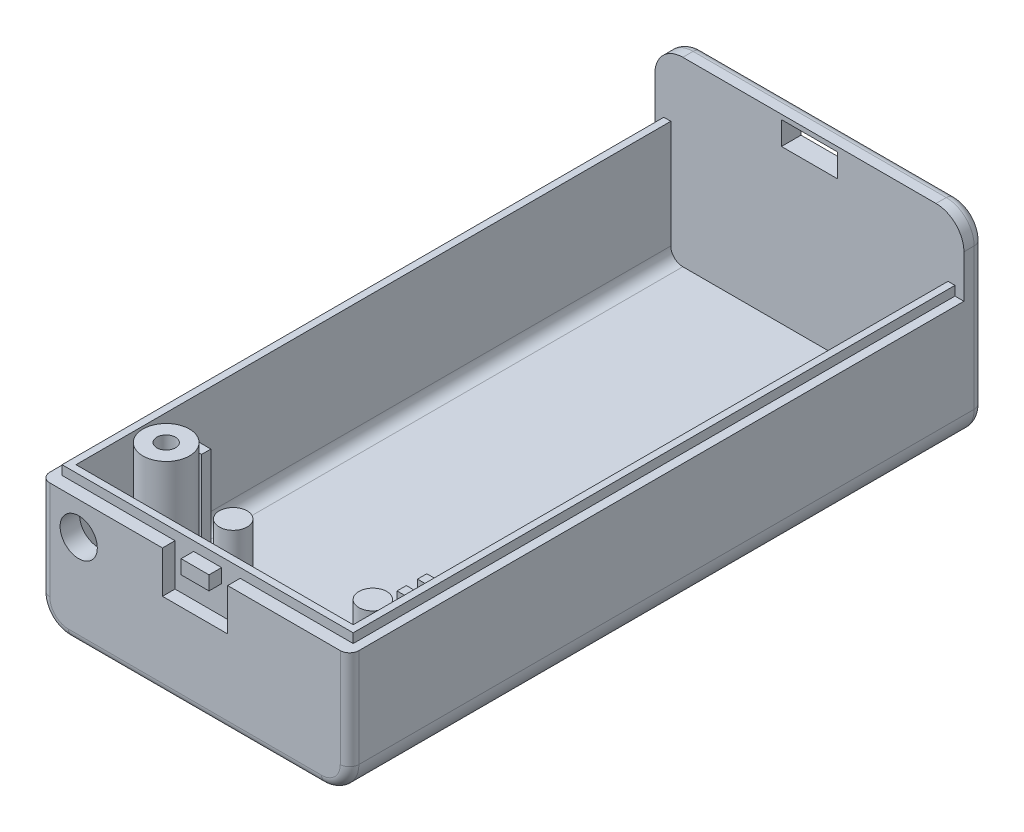
from build123d import *

# Parameters (mm, degrees)
EXTRU_MINCE1_DEPTH         = 32
EXTRU_MINCE1_DEPTH_BACK    = 32
BOSS_EXTRU_1_DEPTH         = 2
BOSS_EXTRU_1_DEPTH_BACK    = 0.1
BOSS_EXTRU_2_START         = 2.1
ESQUISSE3_W                = 6
ESQUISSE3_H                = 2.5
BOSS_EXTRU_2_DEPTH         = 2.1
ESQUISSE4_W                = 7
ESQUISSE4_H                = 5.5
BOSS_EXTRU_3_DEPTH         = 0.75
ENL_V_MAT_EXTRU_2_DEPTH    = 1
CONG_1_R                   = 1
ESQUISSE6_W                = 4
ESQUISSE6_H                = 11.1
BOSS_EXTRU_4_DEPTH         = 1
R_P_TITION_LIN_AIRE1_COUNT = 2
R_P_TITION_LIN_AIRE1_PITCH = 2.2
ESQUISSE7_R                = 2.5
ESQUISSE7_R_2              = 1
BOSS_EXTRU_5_DEPTH         = 15.4
ESQUISSE8_R                = 1.5
BOSS_EXTRU_6_DEPTH         = 11.89
ESQUISSE9_W                = 8
ESQUISSE9_H                = 3.75
ENL_V_MAT_EXTRU_3_DEPTH    = 43.640709422
ESQUISSE10_W               = 0.557692308
ESQUISSE10_H               = 0.173076923
BOSS_EXTRU_7_DEPTH         = 0.1
ENL_V_MAT_EXTRU_5_REACH    = 73.619
ESQUISSE11_R               = 2
ESQUISSE12_W               = 3
ESQUISSE12_H               = 1.5
BOSS_EXTRU_8_DEPTH         = 1.35


with BuildPart() as part:
    # Esquisse1 → Extru.-Mince1 (new, two sides: drawn at the far end of the back side and taken through both)
    with BuildSketch(Plane.XY.offset(-EXTRU_MINCE1_DEPTH_BACK)):
        with BuildLine():
            Line((-16.6, 0), (-16.6, -11.6))
            ThreePointArc((-16.6, -11.6), (-15.721320344, -13.721320344), (-13.6, -14.6))
            Line((-13.6, -14.6), (13.6, -14.6))
            ThreePointArc((13.6, -14.6), (15.721320344, -13.721320344), (16.6, -11.6))
            Line((16.6, -11.6), (16.6, 0))
            Line((16.6, 0), (14.89, 0))
            Line((14.89, 0), (14.89, -11.6))
            ThreePointArc((14.89, -11.6), (14.512167748, -12.512167748), (13.6, -12.89))
            Line((13.6, -12.89), (-13.6, -12.89))
            ThreePointArc((-13.6, -12.89), (-14.512167748, -12.512167748), (-14.89, -11.6))
            Line((-14.89, -11.6), (-14.89, 0))
            Line((-14.89, 0), (-16.6, 0))
        make_face()
    extrude(amount=EXTRU_MINCE1_DEPTH + EXTRU_MINCE1_DEPTH_BACK)

    # Esquisse2 → Boss.-Extru.1 (add, two sides: drawn at the far end of the back side and taken through both)
    with BuildSketch(Plane.XY.offset(32).offset(-BOSS_EXTRU_1_DEPTH_BACK)):
        with BuildLine():
            Line((16.6, -11.6), (16.6, 0))
            Line((16.6, 0), (3.5, 0))
            Line((3.5, 0), (3.5, -5.5))
            Line((3.5, -5.5), (-3.5, -5.5))
            Line((-3.5, -5.5), (-3.5, 0))
            Line((-3.5, 0), (-16.6, 0))
            Line((-16.6, 0), (-16.6, -11.6))
            ThreePointArc((-16.6, -11.6), (-15.721320344, -13.721320344), (-13.6, -14.6))
            Line((-13.6, -14.6), (13.6, -14.6))
            ThreePointArc((13.6, -14.6), (15.721320344, -13.721320344), (16.6, -11.6))
        make_face()
    extrude(amount=BOSS_EXTRU_1_DEPTH + BOSS_EXTRU_1_DEPTH_BACK)

    # Esquisse3 → Boss.-Extru.2 (add)
    with BuildSketch(Plane(origin=(0, 0, -32), x_dir=(-1, 0, 0), z_dir=(0, 0, -1)).offset(BOSS_EXTRU_2_START)):
        with BuildLine():
            Line((-16.6, 3.6), (-16.6, -11.6))
            ThreePointArc((-16.6, -11.6), (-15.721320344, -13.721320344), (-13.6, -14.6))
            Line((-13.6, -14.6), (13.6, -14.6))
            ThreePointArc((13.6, -14.6), (15.721320344, -13.721320344), (16.6, -11.6))
            Line((16.6, -11.6), (16.6, 3.6))
            ThreePointArc((16.6, 3.6), (15.721320344, 5.721320344), (13.6, 6.6))
            Line((13.6, 6.6), (-13.6, 6.6))
            ThreePointArc((-13.6, 6.6), (-15.721320344, 5.721320344), (-16.6, 3.6))
        make_face()
        with Locations((0, 4.85)):
            Rectangle(ESQUISSE3_W, ESQUISSE3_H, mode=Mode.SUBTRACT)
    extrude(amount=-BOSS_EXTRU_2_DEPTH)

    # Esquisse4 → Boss.-Extru.3 (add)
    with BuildSketch(Plane(origin=(0, 0, 31.9), x_dir=(-1, 0, 0), z_dir=(0, 0, -1))):
        with Locations((0, -2.75)):
            Rectangle(ESQUISSE4_W, ESQUISSE4_H)
    extrude(amount=-BOSS_EXTRU_3_DEPTH)

    # Esquisse5 → Enlèv. mat.-Extru.2 (cut)
    with BuildSketch(Plane(origin=(0, 0, 0), x_dir=(1, 0, 0), z_dir=(0, 1, 0))):
        Polygon((-15.64, 32), (-15.64, -32.65), (15.64, -32.65), (15.64, 32), (20.225848864, 32), (20.225848864, -40.091584482), (-17.213856389, -40.091584482), (-17.213856389, 32), align=None)
    extrude(amount=-ENL_V_MAT_EXTRU_2_DEPTH, mode=Mode.SUBTRACT)

    # Congé1
    # the kernel refuses this fillet: 1 mm, written as the material it takes off along each edge
    with BuildSketch(Plane(origin=(-16.6, 1.5, 34), x_dir=(0, 0, -1), z_dir=(0, -1, 0)), Plane(origin=(16.6, -11.6, 34), x_dir=(0, 0, -1), z_dir=(0, 1, 0))) as cong_1_piece_1:
        with BuildLine():
            CenterArc((CONG_1_R, CONG_1_R), CONG_1_R, 180, 90)
            Line((0, CONG_1_R), (0, 0))
            Line((0, 0), (CONG_1_R, 0))
        make_face()
    extrude(amount=13.1, mode=Mode.SUBTRACT)
    with BuildSketch(Plane(origin=(-13.6, -11.6, 34), x_dir=(-1, 0, 0), z_dir=(0, 1, 0))) as cong_1_piece_2:
        with BuildLine():
            CenterArc((3 - CONG_1_R, -CONG_1_R), CONG_1_R, 0, 90)
            Line((3 - CONG_1_R, 0), (3, 0))
            Line((3, 0), (3, -CONG_1_R))
        make_face()
    revolve(axis=Axis((-13.6, -11.6, 34), (0, 0, 1)), revolution_arc=90, mode=Mode.SUBTRACT)
    with BuildSketch(Plane(origin=(-13.6, -14.6, 34), x_dir=(0, 0, -1), z_dir=(1, 0, 0))) as cong_1_piece_3:
        with BuildLine():
            CenterArc((CONG_1_R, CONG_1_R), CONG_1_R, 180, 90)
            Line((0, CONG_1_R), (0, 0))
            Line((0, 0), (CONG_1_R, 0))
        make_face()
    extrude(amount=27.2, mode=Mode.SUBTRACT)
    with BuildSketch(Plane(origin=(13.6, -11.6, 34), x_dir=(0, -1, 0), z_dir=(-1, 0, 0))) as cong_1_piece_4:
        with BuildLine():
            CenterArc((3 - CONG_1_R, -CONG_1_R), CONG_1_R, 0, 90)
            Line((3 - CONG_1_R, 0), (3, 0))
            Line((3, 0), (3, -CONG_1_R))
        make_face()
    revolve(axis=Axis((13.6, -11.6, 34), (0, 0, 1)), revolution_arc=90, mode=Mode.SUBTRACT)
    with BuildSketch(Plane(origin=(-13.6, -11.6, -34.1), x_dir=(0, -1, 0), z_dir=(1, 0, 0))) as cong_1_piece_5:
        with BuildLine():
            CenterArc((3 - CONG_1_R, -CONG_1_R), CONG_1_R, 0, 90)
            Line((3, -CONG_1_R), (3, 0))
            Line((3, 0), (3 - CONG_1_R, 0))
        make_face()
    revolve(axis=Axis((-13.6, -11.6, -34.1), (0, 0, -1)), revolution_arc=90, mode=Mode.SUBTRACT)
    with BuildSketch(Plane(origin=(13.6, -14.6, -34.1), x_dir=(0, 1, 0), z_dir=(-1, 0, 0)), Plane(origin=(-13.6, 6.6, -34.1), x_dir=(0, -1, 0), z_dir=(1, 0, 0))) as cong_1_piece_6:
        with BuildLine():
            CenterArc((CONG_1_R, -CONG_1_R), CONG_1_R, 90, 90)
            Line((0, -CONG_1_R), (0, 0))
            Line((0, 0), (CONG_1_R, 0))
        make_face()
    extrude(amount=27.2, mode=Mode.SUBTRACT)
    with BuildSketch(Plane(origin=(13.6, -11.6, -34.1), x_dir=(1, 0, 0), z_dir=(0, 1, 0))) as cong_1_piece_7:
        with BuildLine():
            CenterArc((3 - CONG_1_R, -CONG_1_R), CONG_1_R, 0, 90)
            Line((3, -CONG_1_R), (3, 0))
            Line((3, 0), (3 - CONG_1_R, 0))
        make_face()
    revolve(axis=Axis((13.6, -11.6, -34.1), (0, 0, -1)), revolution_arc=90, mode=Mode.SUBTRACT)
    with BuildSketch(Plane(origin=(16.6, 3.6, -34.1), x_dir=(-1, 0, 0), z_dir=(0, -1, 0))) as cong_1_piece_8:
        with BuildLine():
            CenterArc((CONG_1_R, -CONG_1_R), CONG_1_R, 90, 90)
            Line((0, -CONG_1_R), (0, 0))
            Line((0, 0), (CONG_1_R, 0))
        make_face()
    extrude(amount=15.2, mode=Mode.SUBTRACT)
    with BuildSketch(Plane(origin=(13.6, 3.6, -34.1), x_dir=(0, 1, 0), z_dir=(-1, 0, 0))) as cong_1_piece_9:
        with BuildLine():
            CenterArc((3 - CONG_1_R, -CONG_1_R), CONG_1_R, 0, 90)
            Line((3, -CONG_1_R), (3, 0))
            Line((3, 0), (3 - CONG_1_R, 0))
        make_face()
    revolve(axis=Axis((13.6, 3.6, -34.1), (0, 0, -1)), revolution_arc=90, mode=Mode.SUBTRACT)
    with BuildSketch(Plane(origin=(-13.6, 3.6, -34.1), x_dir=(-1, 0, 0), z_dir=(0, -1, 0))) as cong_1_piece_10:
        with BuildLine():
            CenterArc((3 - CONG_1_R, -CONG_1_R), CONG_1_R, 0, 90)
            Line((3, -CONG_1_R), (3, 0))
            Line((3, 0), (3 - CONG_1_R, 0))
        make_face()
    revolve(axis=Axis((-13.6, 3.6, -34.1), (0, 0, -1)), revolution_arc=90, mode=Mode.SUBTRACT)
    with BuildSketch(Plane(origin=(-16.6, -11.6, -34.1), x_dir=(0, 0, 1), z_dir=(0, 1, 0))) as cong_1_piece_11:
        with BuildLine():
            CenterArc((CONG_1_R, CONG_1_R), CONG_1_R, 180, 90)
            Line((0, CONG_1_R), (0, 0))
            Line((0, 0), (CONG_1_R, 0))
        make_face()
    extrude(amount=15.2, mode=Mode.SUBTRACT)

    # Esquisse6 → Boss.-Extru.4 (add)
    with BuildSketch(Plane.XY.offset(21.7)):
        with Locations((-13.6, -8.05)):
            Rectangle(ESQUISSE6_W, ESQUISSE6_H)
        with Locations((13.6, -8.05)):
            Rectangle(ESQUISSE6_W, ESQUISSE6_H)
    boss_extru_4 = extrude(amount=-BOSS_EXTRU_4_DEPTH)

    # Répétition linéaire1: Boss.-Extru.4 ×2
    with Locations(*[(0, 0, i * R_P_TITION_LIN_AIRE1_PITCH) for i in range(1, R_P_TITION_LIN_AIRE1_COUNT)]):
        add(boss_extru_4)

    # Esquisse7 → Boss.-Extru.5 (add)
    with BuildSketch(Plane(origin=(0, -12.89, 0), x_dir=(1, 0, 0), z_dir=(0, 1, 0))):
        with Locations((-9.6, -27.5)):
            Circle(ESQUISSE7_R)
        with Locations((-9.6, -27.5)):
            Circle(ESQUISSE7_R_2, mode=Mode.SUBTRACT)
    extrude(amount=BOSS_EXTRU_5_DEPTH)

    # Esquisse8 → Boss.-Extru.6 (add)
    with BuildSketch(Plane(origin=(0, -12.89, 0), x_dir=(1, 0, 0), z_dir=(0, 1, 0))):
        with Locations(Location((12.6, -27.5, 0), (0, 0, 311.810314896))):
            Circle(ESQUISSE8_R)
        with Locations((-2.4, -27.5)):
            Circle(ESQUISSE8_R)
    extrude(amount=BOSS_EXTRU_6_DEPTH)

    # Esquisse9 → Enlèv. mat.-Extru.3 (cut, through all)
    with BuildSketch(Plane(origin=(0, -12.89, 0), x_dir=(1, 0, 0), z_dir=(0, 1, 0))):
        with Locations((6.1, -27.5)):
            Rectangle(ESQUISSE9_W, ESQUISSE9_H)
    extrude(amount=-ENL_V_MAT_EXTRU_3_DEPTH, mode=Mode.SUBTRACT)

    # Esquisse10 → Boss.-Extru.7 (add)
    # profile 1 of 6: a face of its own
    with BuildSketch(Plane.XZ.offset(14.6)):
        with BuildLine():
            add(Edge.make_bspline(
                [(2.279833847, 24.273406537), (2.280355189, 24.303480244), (2.281370998, 24.362077337), (2.290862249, 24.447402256), (2.306273604, 24.527681842), (2.3283055, 24.602909844), (2.356230991, 24.673204142), (2.390179761, 24.738723908), (2.431172965, 24.798727505), (2.477546724, 24.853786129), (2.529344084, 24.902461988), (2.58449355, 24.945693125), (2.643683766, 24.981753004), (2.706367859, 25.011526576), (2.772812149, 25.034385863), (2.842830078, 25.050389443), (2.916346764, 25.060713308), (2.966597139, 25.061875293), (2.992273751, 25.062469037)],
                knots=[0, 0, 0, 0, 1.203621547, 2.345195544, 3.432004029, 4.472479546, 5.478447225, 6.455936844, 7.420185704, 8.381829745, 9.332027588, 10.260832629, 11.182364398, 12.100723901, 13.034044877, 13.989196293, 14.972532542, 16, 16, 16, 16], degree=3))
            add(Edge.make_bspline(
                [(2.992273751, 25.062469037), (3.00920924, 25.062173312), (3.04284006, 25.061586054), (3.092560224, 25.057117809), (3.141002756, 25.049142767), (3.18811995, 25.038455315), (3.23404006, 25.024433844), (3.27879051, 25.007881923), (3.321979557, 24.987371763), (3.363894529, 24.964408598), (3.404040649, 24.938723304), (3.441769873, 24.910348813), (3.476991826, 24.879499719), (3.510179635, 24.846683096), (3.540225869, 24.81079143), (3.568371815, 24.772918043), (3.593808683, 24.732391377), (3.616626728, 24.689543481), (3.637028379, 24.645036132), (3.65446553, 24.598684865), (3.669438493, 24.551045697), (3.681972126, 24.501836654), (3.690965346, 24.451074559), (3.698126744, 24.398978141), (3.701895986, 24.345377132), (3.702569655, 24.309168695), (3.70291077, 24.290834422)],
                knots=[0, 0, 0, 0, 1.034375294, 2.054082248, 3.045783978, 4.031219655, 5.002789406, 5.976610191, 6.94273282, 7.920236376, 8.894345378, 9.851183672, 10.800797181, 11.752517031, 12.698794154, 13.65688337, 14.632873302, 15.61821402, 16.620222298, 17.621258913, 18.640965868, 19.669244166, 20.720417492, 21.788124603, 22.880008887, 24, 24, 24, 24], degree=3))
            add(Edge.make_bspline(
                [(3.70291077, 24.290834422), (3.702598235, 24.272197816), (3.701980767, 24.235377988), (3.697802729, 24.180983837), (3.690456287, 24.128151229), (3.680712481, 24.076722627), (3.66765608, 24.026805094), (3.652140553, 23.978255515), (3.633373647, 23.931363059), (3.612178509, 23.886014707), (3.588196221, 23.842834156), (3.561742129, 23.802123345), (3.532797493, 23.76426309), (3.501801979, 23.728788943), (3.468031759, 23.696335249), (3.431902668, 23.666598541), (3.393553621, 23.639298369), (3.352855785, 23.615174107), (3.310539538, 23.594028329), (3.267442253, 23.575268215), (3.223531915, 23.559268842), (3.178658453, 23.546302941), (3.132944276, 23.536504973), (3.086518031, 23.529168151), (3.039227524, 23.524943584), (3.007406017, 23.524321131), (2.991372308, 23.524007499)],
                knots=[0, 0, 0, 0, 1.141429366, 2.255090526, 3.338676798, 4.407031443, 5.458968682, 6.496860253, 7.526652771, 8.550250826, 9.560787671, 10.54935636, 11.521089193, 12.477323897, 13.431786008, 14.386110112, 15.340986122, 16.312041, 17.28047646, 18.236612773, 19.189437236, 20.140779471, 21.09494583, 22.051062463, 23.018000708, 24, 24, 24, 24], degree=3))
            add(Edge.make_bspline(
                [(2.991372308, 23.524007499), (2.97413251, 23.524262564), (2.939984787, 23.524767783), (2.889513533, 23.529810738), (2.840297924, 23.537503941), (2.792481039, 23.548610602), (2.746128218, 23.563100026), (2.701184615, 23.580637567), (2.657492159, 23.60098884), (2.615593, 23.624736569), (2.575629746, 23.651141491), (2.537989736, 23.680072349), (2.502693782, 23.711262518), (2.470308242, 23.745227535), (2.439784248, 23.780736156), (2.412342288, 23.819108212), (2.387086149, 23.859473467), (2.364763202, 23.902221024), (2.344597761, 23.946080587), (2.327607941, 23.991066187), (2.312677182, 24.036514854), (2.300786344, 24.082706716), (2.291310793, 24.129535218), (2.284939171, 24.17692244), (2.280337538, 24.224938956), (2.280002589, 24.257169375), (2.279833847, 24.273406537)],
                knots=[0, 0, 0, 0, 1.072727997, 2.12480551, 3.153819198, 4.171534612, 5.177148798, 6.173931848, 7.17235114, 8.174500385, 9.168706755, 10.151274001, 11.127173509, 12.097141049, 13.070188938, 14.039134204, 15.03036519, 16.031505612, 17.038625933, 18.033164522, 19.022845559, 20.014762458, 21.000193215, 21.994692725, 22.989758729, 24, 24, 24, 24], degree=3))
        make_face()
        with BuildLine():
            add(Edge.make_bspline(
                [(2.491372308, 24.271002691), (2.491696481, 24.249346908), (2.492328595, 24.207119661), (2.499560319, 24.145554579), (2.510533306, 24.087464789), (2.525658409, 24.03268722), (2.545990253, 23.981763612), (2.570299604, 23.934204639), (2.599404965, 23.890326447), (2.632664184, 23.850251781), (2.669245512, 23.814251703), (2.708336374, 23.78280755), (2.749945556, 23.756475296), (2.793611748, 23.734732399), (2.839648583, 23.717760086), (2.887918179, 23.705842555), (2.938456004, 23.698389106), (2.972916568, 23.697524735), (2.990470866, 23.697084422)],
                knots=[0, 0, 0, 0, 1.215430442, 2.370003584, 3.475209778, 4.53279855, 5.55522989, 6.548792651, 7.526809858, 8.505409025, 9.467826767, 10.404123909, 11.316848639, 12.227335424, 13.138360512, 14.065900994, 15.014765094, 16, 16, 16, 16], degree=3))
            add(Edge.make_bspline(
                [(2.990470866, 23.697084422), (3.00832271, 23.697531247), (3.043276571, 23.698406131), (3.094576322, 23.705729465), (3.143316828, 23.71819713), (3.189981195, 23.734794417), (3.233725775, 23.757231119), (3.275573631, 23.783504374), (3.314383983, 23.815609539), (3.351109516, 23.851673287), (3.384049846, 23.892666359), (3.413277454, 23.937578967), (3.437019905, 23.987084685), (3.457518307, 24.04009297), (3.472528419, 24.097605699), (3.483621811, 24.158969067), (3.490306924, 24.224380461), (3.491010901, 24.26928417), (3.491372308, 24.292336826)],
                knots=[0, 0, 0, 0, 0.976878588, 1.912725521, 2.8289017, 3.727303729, 4.617335839, 5.514666588, 6.426584173, 7.368641557, 8.327632997, 9.299405846, 10.294892156, 11.327373912, 12.405931897, 13.542618837, 14.738430195, 16, 16, 16, 16], degree=3))
            add(Edge.make_bspline(
                [(3.491372308, 24.292336826), (3.491244587, 24.307167404), (3.490994044, 24.336259632), (3.487676016, 24.379141909), (3.483396186, 24.420690301), (3.476880078, 24.460851197), (3.467900055, 24.499458281), (3.457951714, 24.536805469), (3.445511662, 24.572570924), (3.431396688, 24.606894905), (3.415602272, 24.639601198), (3.397788272, 24.670414077), (3.378161722, 24.699213747), (3.35725217, 24.726546222), (3.333901762, 24.751353623), (3.309234836, 24.774683826), (3.282691083, 24.796054823), (3.254535399, 24.815472198), (3.225167209, 24.832950895), (3.194647056, 24.847910392), (3.16346117, 24.86105043), (3.131087542, 24.871122822), (3.09797319, 24.879246353), (3.063984248, 24.885416931), (3.028994558, 24.888612344), (3.005400324, 24.889130324), (2.993475674, 24.889392114)],
                knots=[0, 0, 0, 0, 1.220438779, 2.394059227, 3.538503547, 4.658058814, 5.74010225, 6.800155734, 7.837851593, 8.854470756, 9.853724944, 10.825214244, 11.781044712, 12.72106398, 13.654479919, 14.581868691, 15.514082315, 16.456304431, 17.39516604, 18.324312202, 19.252140633, 20.177768678, 21.111585046, 22.057694709, 23.018348693, 24, 24, 24, 24], degree=3))
            add(Edge.make_bspline(
                [(2.993475674, 24.889392114), (2.976621807, 24.889057403), (2.943367251, 24.888396981), (2.894412586, 24.881055361), (2.847214981, 24.870085977), (2.80170119, 24.854750195), (2.758260486, 24.834443209), (2.716667806, 24.809539469), (2.676553955, 24.780717066), (2.63855147, 24.747273748), (2.603124842, 24.70885554), (2.573175182, 24.663561649), (2.54793279, 24.612473336), (2.526855858, 24.555720099), (2.510785318, 24.492862421), (2.499678565, 24.424170807), (2.492665987, 24.349572875), (2.491814559, 24.297862302), (2.491372308, 24.271002691)],
                knots=[0, 0, 0, 0, 0.895090134, 1.766112571, 2.624765742, 3.468151641, 4.313618154, 5.168136083, 6.041303099, 6.935189387, 7.854749729, 8.809996334, 9.809869957, 10.877771942, 12.021723904, 13.25217762, 14.572720513, 16, 16, 16, 16], degree=3))
        make_face(mode=Mode.SUBTRACT)
    # profile 2 of 6: a face of its own
    with BuildSketch(Plane.XZ.offset(14.6)):
        Polygon((3.972141539, 23.543238268), (3.972141539, 25.043238268), (4.972141539, 25.043238268), (4.972141539, 24.870161345), (4.183680001, 24.870161345), (4.183680001, 24.389392114), (4.856756924, 24.389392114), (4.856756924, 24.216315191), (4.183680001, 24.216315191), (4.183680001, 23.543238268), align=None)
    # profile 3 of 6: a face of its own
    with BuildSketch(Plane.XZ.offset(14.6)):
        Polygon((5.241372308, 23.543238268), (5.241372308, 25.043238268), (6.241372308, 25.043238268), (6.241372308, 24.870161345), (5.45291077, 24.870161345), (5.45291077, 24.389392114), (6.125987693, 24.389392114), (6.125987693, 24.216315191), (5.45291077, 24.216315191), (5.45291077, 23.543238268), align=None)
    # profile 4 of 6: a face of its own
    with BuildSketch(Plane.XZ.offset(14.6)):
        with Locations((6.674064616, 24.072084422)):
            Rectangle(ESQUISSE10_W, ESQUISSE10_H)
    # profile 5 of 6: a face of its own
    with BuildSketch(Plane.XZ.offset(14.6)):
        with BuildLine():
            add(Edge.make_bspline(
                [(7.125987693, 24.273406537), (7.126509035, 24.303480244), (7.127524844, 24.362077337), (7.137016095, 24.447402256), (7.15242745, 24.527681842), (7.174459346, 24.602909844), (7.202384838, 24.673204142), (7.236333607, 24.738723908), (7.277326811, 24.798727505), (7.323700571, 24.853786129), (7.37549793, 24.902461988), (7.430647396, 24.945693125), (7.489837612, 24.981753004), (7.552521706, 25.011526576), (7.618965995, 25.034385863), (7.688983924, 25.050389443), (7.76250061, 25.060713308), (7.812750985, 25.061875293), (7.838427597, 25.062469037)],
                knots=[0, 0, 0, 0, 1.203621547, 2.345195544, 3.432004029, 4.472479546, 5.478447225, 6.455936844, 7.420185704, 8.381829745, 9.332027588, 10.260832629, 11.182364398, 12.100723901, 13.034044877, 13.989196293, 14.972532542, 16, 16, 16, 16], degree=3))
            add(Edge.make_bspline(
                [(7.838427597, 25.062469037), (7.855363086, 25.062173312), (7.888993906, 25.061586054), (7.93871407, 25.057117809), (7.987156602, 25.049142767), (8.034273796, 25.038455315), (8.080193906, 25.024433844), (8.124944356, 25.007881923), (8.168133403, 24.987371763), (8.210048375, 24.964408598), (8.250194495, 24.938723304), (8.287923719, 24.910348813), (8.323145672, 24.879499719), (8.356333481, 24.846683096), (8.386379715, 24.81079143), (8.414525662, 24.772918043), (8.439962529, 24.732391377), (8.462780575, 24.689543481), (8.483182226, 24.645036132), (8.500619376, 24.598684865), (8.515592339, 24.551045697), (8.528125972, 24.501836654), (8.537119192, 24.451074559), (8.544280591, 24.398978141), (8.548049832, 24.345377132), (8.548723501, 24.309168695), (8.549064616, 24.290834422)],
                knots=[0, 0, 0, 0, 1.034375294, 2.054082248, 3.045783978, 4.031219655, 5.002789406, 5.976610191, 6.94273282, 7.920236376, 8.894345378, 9.851183672, 10.800797181, 11.752517031, 12.698794154, 13.65688337, 14.632873302, 15.61821402, 16.620222298, 17.621258913, 18.640965868, 19.669244166, 20.720417492, 21.788124603, 22.880008887, 24, 24, 24, 24], degree=3))
            add(Edge.make_bspline(
                [(8.549064616, 24.290834422), (8.548752081, 24.272197816), (8.548134613, 24.235377988), (8.543956575, 24.180983837), (8.536610133, 24.128151229), (8.526866328, 24.076722627), (8.513809926, 24.026805094), (8.498294399, 23.978255515), (8.479527493, 23.931363059), (8.458332356, 23.886014707), (8.434350067, 23.842834156), (8.407895975, 23.802123345), (8.378951339, 23.76426309), (8.347955825, 23.728788943), (8.314185605, 23.696335249), (8.278056514, 23.666598541), (8.239707467, 23.639298369), (8.199009631, 23.615174107), (8.156693384, 23.594028329), (8.113596099, 23.575268215), (8.069685761, 23.559268842), (8.024812299, 23.546302941), (7.979098122, 23.536504973), (7.932671877, 23.529168151), (7.885381371, 23.524943584), (7.853559864, 23.524321131), (7.837526154, 23.524007499)],
                knots=[0, 0, 0, 0, 1.141429366, 2.255090526, 3.338676798, 4.407031443, 5.458968682, 6.496860253, 7.526652771, 8.550250826, 9.560787671, 10.54935636, 11.521089193, 12.477323897, 13.431786008, 14.386110112, 15.340986122, 16.312041, 17.28047646, 18.236612773, 19.189437236, 20.140779471, 21.09494583, 22.051062463, 23.018000708, 24, 24, 24, 24], degree=3))
            add(Edge.make_bspline(
                [(7.837526154, 23.524007499), (7.820286356, 23.524262564), (7.786138633, 23.524767783), (7.735667379, 23.529810738), (7.68645177, 23.537503941), (7.638634885, 23.548610602), (7.592282064, 23.563100026), (7.547338461, 23.580637567), (7.503646005, 23.60098884), (7.461746846, 23.624736569), (7.421783592, 23.651141491), (7.384143582, 23.680072349), (7.348847629, 23.711262518), (7.316462088, 23.745227535), (7.285938094, 23.780736156), (7.258496134, 23.819108212), (7.233239995, 23.859473467), (7.210917049, 23.902221024), (7.190751607, 23.946080587), (7.173761787, 23.991066187), (7.158831028, 24.036514854), (7.14694019, 24.082706716), (7.137464639, 24.129535218), (7.131093017, 24.17692244), (7.126491384, 24.224938956), (7.126156435, 24.257169375), (7.125987693, 24.273406537)],
                knots=[0, 0, 0, 0, 1.072727997, 2.12480551, 3.153819198, 4.171534612, 5.177148798, 6.173931848, 7.17235114, 8.174500385, 9.168706755, 10.151274001, 11.127173509, 12.097141049, 13.070188938, 14.039134204, 15.03036519, 16.031505612, 17.038625933, 18.033164522, 19.022845559, 20.014762458, 21.000193215, 21.994692725, 22.989758729, 24, 24, 24, 24], degree=3))
        make_face()
        with BuildLine():
            add(Edge.make_bspline(
                [(7.337526154, 24.271002691), (7.337850327, 24.249346908), (7.338482441, 24.207119661), (7.345714165, 24.145554579), (7.356687152, 24.087464789), (7.371812256, 24.03268722), (7.392144099, 23.981763612), (7.41645345, 23.934204639), (7.445558811, 23.890326447), (7.47881803, 23.850251781), (7.515399358, 23.814251703), (7.55449022, 23.78280755), (7.596099403, 23.756475296), (7.639765594, 23.734732399), (7.685802429, 23.717760086), (7.734072025, 23.705842555), (7.78460985, 23.698389106), (7.819070414, 23.697524735), (7.836624712, 23.697084422)],
                knots=[0, 0, 0, 0, 1.215430442, 2.370003584, 3.475209778, 4.53279855, 5.55522989, 6.548792651, 7.526809858, 8.505409025, 9.467826767, 10.404123909, 11.316848639, 12.227335424, 13.138360512, 14.065900994, 15.014765094, 16, 16, 16, 16], degree=3))
            add(Edge.make_bspline(
                [(7.836624712, 23.697084422), (7.854476556, 23.697531247), (7.889430417, 23.698406131), (7.940730168, 23.705729465), (7.989470674, 23.71819713), (8.036135041, 23.734794417), (8.079879621, 23.757231119), (8.121727477, 23.783504374), (8.160537829, 23.815609539), (8.197263362, 23.851673287), (8.230203692, 23.892666359), (8.2594313, 23.937578967), (8.283173751, 23.987084685), (8.303672153, 24.04009297), (8.318682265, 24.097605699), (8.329775657, 24.158969067), (8.33646077, 24.224380461), (8.337164747, 24.26928417), (8.337526154, 24.292336826)],
                knots=[0, 0, 0, 0, 0.976878588, 1.912725521, 2.8289017, 3.727303729, 4.617335839, 5.514666588, 6.426584173, 7.368641557, 8.327632997, 9.299405846, 10.294892156, 11.327373912, 12.405931897, 13.542618837, 14.738430195, 16, 16, 16, 16], degree=3))
            add(Edge.make_bspline(
                [(8.337526154, 24.292336826), (8.337398433, 24.307167404), (8.33714789, 24.336259632), (8.333829863, 24.379141909), (8.329550032, 24.420690301), (8.323033925, 24.460851197), (8.314053901, 24.499458281), (8.30410556, 24.536805469), (8.291665508, 24.572570924), (8.277550535, 24.606894905), (8.261756119, 24.639601198), (8.243942118, 24.670414077), (8.224315568, 24.699213747), (8.203406016, 24.726546222), (8.180055609, 24.751353623), (8.155388682, 24.774683826), (8.128844929, 24.796054823), (8.100689245, 24.815472198), (8.071321055, 24.832950895), (8.040800902, 24.847910392), (8.009615016, 24.86105043), (7.977241388, 24.871122822), (7.944127036, 24.879246353), (7.910138094, 24.885416931), (7.875148404, 24.888612344), (7.85155417, 24.889130324), (7.83962952, 24.889392114)],
                knots=[0, 0, 0, 0, 1.220438779, 2.394059227, 3.538503547, 4.658058814, 5.74010225, 6.800155734, 7.837851593, 8.854470756, 9.853724944, 10.825214244, 11.781044712, 12.72106398, 13.654479919, 14.581868691, 15.514082315, 16.456304431, 17.39516604, 18.324312202, 19.252140633, 20.177768678, 21.111585046, 22.057694709, 23.018348693, 24, 24, 24, 24], degree=3))
            add(Edge.make_bspline(
                [(7.83962952, 24.889392114), (7.822775654, 24.889057403), (7.789521097, 24.888396981), (7.740566432, 24.881055361), (7.693368827, 24.870085977), (7.647855036, 24.854750195), (7.604414332, 24.834443209), (7.562821652, 24.809539469), (7.522707801, 24.780717066), (7.484705316, 24.747273748), (7.449278688, 24.70885554), (7.419329028, 24.663561649), (7.394086636, 24.612473336), (7.373009704, 24.555720099), (7.356939164, 24.492862421), (7.345832411, 24.424170807), (7.338819833, 24.349572875), (7.337968405, 24.297862302), (7.337526154, 24.271002691)],
                knots=[0, 0, 0, 0, 0.895090134, 1.766112571, 2.624765742, 3.468151641, 4.313618154, 5.168136083, 6.041303099, 6.935189387, 7.854749729, 8.809996334, 9.809869957, 10.877771942, 12.021723904, 13.25217762, 14.572720513, 16, 16, 16, 16], degree=3))
        make_face(mode=Mode.SUBTRACT)
    # profile 6 of 6: a face of its own
    with BuildSketch(Plane.XZ.offset(14.6)):
        Polygon((8.818295385, 23.543238268), (8.818295385, 25.043238268), (9.041853078, 25.043238268), (9.760603078, 23.923947403), (9.760603078, 25.043238268), (9.972141539, 25.043238268), (9.972141539, 23.543238268), (9.748583847, 23.543238268), (9.029833847, 24.662529133), (9.029833847, 23.543238268), align=None)
    extrude(amount=BOSS_EXTRU_7_DEPTH)

    # Esquisse11 → Enlèv. mat.-Extru.5 (cut, up to next)
    with BuildSketch(Plane.XY.offset(34), mode=Mode.PRIVATE) as enl_v_mat_extru_5_sk1:
        with Locations((-12.5, -4.5)):
            Circle(ESQUISSE11_R)
    enl_v_mat_extru_5_tool1 = extrude(enl_v_mat_extru_5_sk1.sketch, amount=-ENL_V_MAT_EXTRU_5_REACH, mode=Mode.PRIVATE) & part.part
    add(enl_v_mat_extru_5_tool1.solids().sort_by_distance((-12.5, -4.5, 34))[0], mode=Mode.SUBTRACT)

    # Esquisse12 → Boss.-Extru.8 (add)
    with BuildSketch(Plane.XY.offset(32.65)):
        with Locations((0, -1.75)):
            Rectangle(ESQUISSE12_W, ESQUISSE12_H)
    extrude(amount=BOSS_EXTRU_8_DEPTH)


solid = part.part
